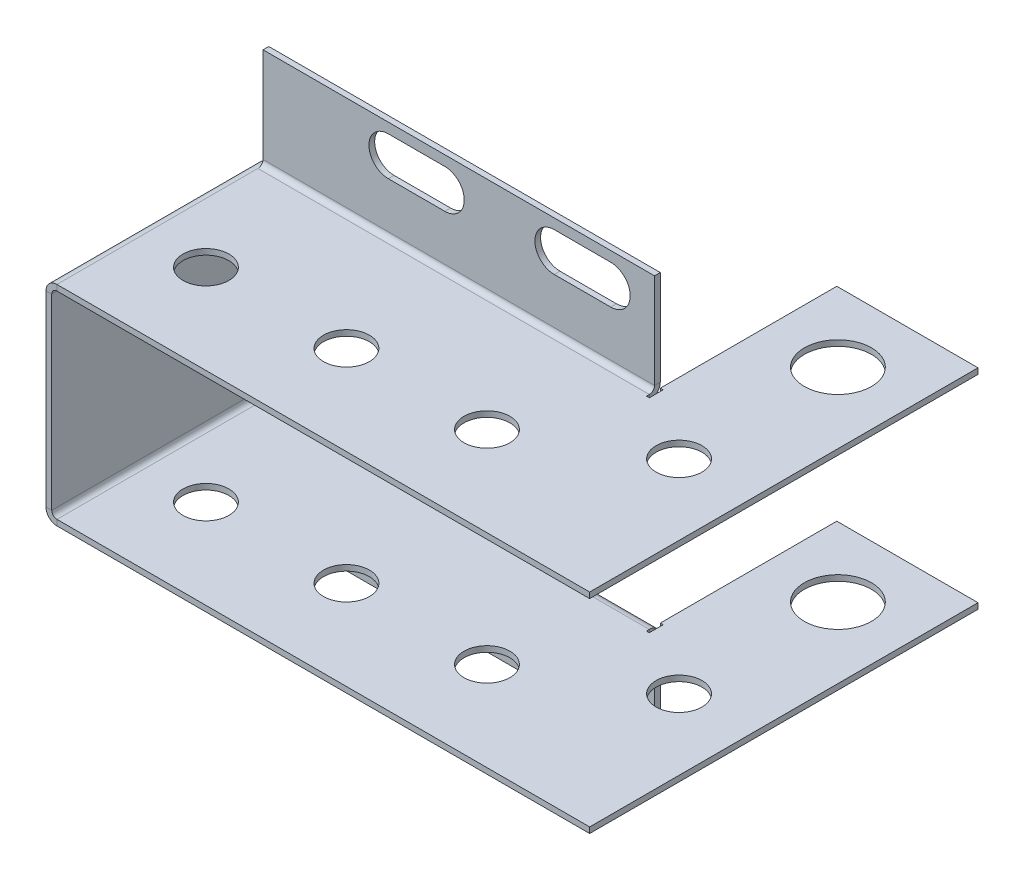
from build123d import *

# Parameters (mm, degrees)
SKETCH7_W                    = 29.6256
SKETCH7_H                    = 30
BASE_FLANGE2_DEPTH           = 0.8128
EDGE_FLANGE1_STRIP_W         = 4.7244
EDGE_FLANGE1_STRIP_H         = 0.8128
EDGE_FLANGE1_STRIP_CUT_DEPTH = 30
EDGE_FLANGE1_DEPTH           = 30
EDGE_FLANGE1_FLAT_DEPTH      = 0.8128
EDGE_FLANGE3_START           = 0.7366
EDGE_FLANGE3_DEPTH           = 55.857
EDGE_FLANGE3_START_2         = 56.1872
EDGE_FLANGE3_2_DEPTH         = 0.4064
EDGE_FLANGE3_3_DEPTH         = 55.4506
CUT_EXTRUDE1_REACH           = 93.006
SKETCH21_R                   = 4.75
SKETCH21_R_2                 = 3.25
CUT_EXTRUDE2_REACH           = 88.587


# Read off the part's stored shape, not the designer's step: Edge-Flange3
# Sheet-metal steps are written as plain solids
with BuildPart() as part:
    # Sketch7 → Base-Flange2 (new body)
    with BuildSketch(Plane.YZ):
        Rectangle(SKETCH7_W, SKETCH7_H)
    extrude(amount=-BASE_FLANGE2_DEPTH)

    # Edge-Flange1 strip (across the edge) → Edge-Flange1 strip cut (cut)
    with BuildSketch(Plane(origin=(0, 14.8128, -15), x_dir=(0, -1, 0), z_dir=(0, 0, 1))):
        with Locations((-0.8128, -0.4064)):
            Rectangle(EDGE_FLANGE1_STRIP_W, EDGE_FLANGE1_STRIP_H)
    edge_flange1_strip_cut = extrude(amount=EDGE_FLANGE1_STRIP_CUT_DEPTH, mode=Mode.SUBTRACT)

    # Edge-Flange1 bend section (across the edge) → Edge-Flange1 (add)
    with BuildSketch(Plane(origin=(0, 14.8128, -15), x_dir=(0, -1, 0), z_dir=(0, 0, 1))):
        with BuildLine():
            Line((0, 0.7366), (0.8128, 0.7366))
            ThreePointArc((0.8128, 0.7366), (1.028545145, 0.215745145), (1.5494, 0))
            Line((1.5494, 0), (1.5494, -0.8128))
            ThreePointArc((1.5494, -0.8128), (0.453808753, -0.358991247), (0, 0.7366))
        make_face()
    edge_flange1 = extrude(amount=EDGE_FLANGE1_DEPTH)

    # Edge-Flange1 profile (on flange) → Edge-Flange1 flat (add)
    with BuildSketch(Plane.ZX.offset(14.8128)):
        Polygon((-40, 56.1872), (-15, 56.1872), (-15, 0.7366), (15, 0.7366), (15, 76.1872), (-40, 76.1872), align=None)
    edge_flange1_flat = extrude(amount=-EDGE_FLANGE1_FLAT_DEPTH)

    # Edge-Flange3 outline → Edge-Flange3 (cut)
    with BuildSketch(Plane.YZ.offset(EDGE_FLANGE3_START)):
        with BuildLine():
            Line((14.8128, -15), (14.8128, -14.813707039))
            ThreePointArc((14.8128, -14.813707039), (14.218624211, -14.244121367), (14, -13.4506))
            Line((14, -13.4506), (14, -15))
            Line((14, -15), (14.8128, -15))
        make_face()
    edge_flange3 = extrude(amount=EDGE_FLANGE3_DEPTH, mode=Mode.SUBTRACT)

    # Edge-Flange3 2 outline → Edge-Flange3 2 (cut)
    with BuildSketch(Plane.YZ.offset(EDGE_FLANGE3_START_2)):
        with BuildLine():
            ThreePointArc((14, -13.4506), (14.218624211, -14.244121367), (14.8128, -14.813707039))
            Line((14.8128, -14.813707039), (14.8128, -13.0442))
            Line((14.8128, -13.0442), (14, -13.0442))
            Line((14, -13.0442), (14, -13.4506))
        make_face()
    edge_flange3_2 = extrude(amount=EDGE_FLANGE3_2_DEPTH, mode=Mode.SUBTRACT)

    # Edge-Flange3 3 outline → Edge-Flange3 3 (add)
    with BuildSketch(Plane.YZ.offset(EDGE_FLANGE3_START)):
        with BuildLine():
            Line((15.5494, -15), (29, -15))
            Line((29, -15), (29, -14.1872))
            Line((29, -14.1872), (15.5494, -14.1872))
            ThreePointArc((15.5494, -14.1872), (15.028545145, -13.971454855), (14.8128, -13.4506))
            Line((14.8128, -13.4506), (14.8128, -14.813707039))
            ThreePointArc((14.8128, -14.813707039), (15.169503755, -14.952704924), (15.5494, -15))
        make_face()
    edge_flange3_3 = extrude(amount=EDGE_FLANGE3_3_DEPTH)

    # Sketch21 → Cut-Extrude1 (cut, up to next)
    with BuildSketch(Plane(origin=(0, 14.8128, 0), x_dir=(-1, 0, 0), z_dir=(0, 1, 0)), mode=Mode.PRIVATE) as cut_extrude1_sk1:
        with Locations((-66.1872, -30.16)):
            Circle(SKETCH21_R)
    cut_extrude1_tool1 = extrude(cut_extrude1_sk1.sketch, amount=-CUT_EXTRUDE1_REACH, mode=Mode.PRIVATE) & part.part
    # Sketch21 → Cut-Extrude1 (cut, up to next)
    with BuildSketch(Plane(origin=(0, 14.8128, 0), x_dir=(-1, 0, 0), z_dir=(0, 1, 0)), mode=Mode.PRIVATE) as cut_extrude1_sk2:
        with Locations((-66.1872, -7.66)):
            Circle(SKETCH21_R_2)
    cut_extrude1_tool2 = extrude(cut_extrude1_sk2.sketch, amount=-CUT_EXTRUDE1_REACH, mode=Mode.PRIVATE) & part.part
    # Sketch21 → Cut-Extrude1 (cut, up to next)
    with BuildSketch(Plane(origin=(0, 14.8128, 0), x_dir=(-1, 0, 0), z_dir=(0, 1, 0)), mode=Mode.PRIVATE) as cut_extrude1_sk3:
        with Locations((-48.982258849, 2.34)):
            Circle(SKETCH21_R_2)
    cut_extrude1_tool3 = extrude(cut_extrude1_sk3.sketch, amount=-CUT_EXTRUDE1_REACH, mode=Mode.PRIVATE) & part.part
    # Sketch21 → Cut-Extrude1 (cut, up to next)
    with BuildSketch(Plane(origin=(0, 14.8128, 0), x_dir=(-1, 0, 0), z_dir=(0, 1, 0)), mode=Mode.PRIVATE) as cut_extrude1_sk4:
        with Locations((-29.082258849, 2.34)):
            Circle(SKETCH21_R_2)
    cut_extrude1_tool4 = extrude(cut_extrude1_sk4.sketch, amount=-CUT_EXTRUDE1_REACH, mode=Mode.PRIVATE) & part.part
    # Sketch21 → Cut-Extrude1 (cut, up to next)
    with BuildSketch(Plane(origin=(0, 14.8128, 0), x_dir=(-1, 0, 0), z_dir=(0, 1, 0)), mode=Mode.PRIVATE) as cut_extrude1_sk5:
        with Locations((-9.182258849, 2.34)):
            Circle(SKETCH21_R_2)
    cut_extrude1_tool5 = extrude(cut_extrude1_sk5.sketch, amount=-CUT_EXTRUDE1_REACH, mode=Mode.PRIVATE) & part.part
    cut_extrude1_1 = cut_extrude1_tool1.solids().sort_by_distance((66.1872, 14.8128, -30.16))[0]
    add(cut_extrude1_1, mode=Mode.SUBTRACT)
    cut_extrude1_2 = cut_extrude1_tool2.solids().sort_by_distance((66.1872, 14.8128, -7.66))[0]
    add(cut_extrude1_2, mode=Mode.SUBTRACT)
    cut_extrude1_3 = cut_extrude1_tool3.solids().sort_by_distance((48.982259, 14.8128, 2.34))[0]
    add(cut_extrude1_3, mode=Mode.SUBTRACT)
    cut_extrude1_4 = cut_extrude1_tool4.solids().sort_by_distance((29.082259, 14.8128, 2.34))[0]
    add(cut_extrude1_4, mode=Mode.SUBTRACT)
    cut_extrude1_5 = cut_extrude1_tool5.solids().sort_by_distance((9.182259, 14.8128, 2.34))[0]
    add(cut_extrude1_5, mode=Mode.SUBTRACT)
    cut_extrude1 = cut_extrude1_1 + cut_extrude1_2 + cut_extrude1_3 + cut_extrude1_4 + cut_extrude1_5  # Cut-Extrude1 as one shape, for the pattern or mirror that repeats it

    # Sketch22 → Cut-Extrude2 (cut, up to next)
    with BuildSketch(Plane.XY.offset(-14.1872), mode=Mode.PRIVATE) as cut_extrude2_sk1:
        with BuildLine():
            Line((18.4866, 27.5628), (26.4866, 27.5628))
            ThreePointArc((26.4866, 27.5628), (29.2366, 24.8128), (26.4866, 22.0628))
            Line((26.4866, 22.0628), (18.4866, 22.0628))
            ThreePointArc((18.4866, 22.0628), (15.7366, 24.8128), (18.4866, 27.5628))
        make_face()
    cut_extrude2_tool1 = extrude(cut_extrude2_sk1.sketch, amount=-CUT_EXTRUDE2_REACH, mode=Mode.PRIVATE) & part.part
    # Sketch22 → Cut-Extrude2 (cut, up to next)
    with BuildSketch(Plane.XY.offset(-14.1872), mode=Mode.PRIVATE) as cut_extrude2_sk2:
        with BuildLine():
            Line((49.9866, 27.5628), (41.9866, 27.5628))
            ThreePointArc((41.9866, 27.5628), (39.2366, 24.8128), (41.9866, 22.0628))
            Line((41.9866, 22.0628), (49.9866, 22.0628))
            ThreePointArc((49.9866, 22.0628), (52.7366, 24.8128), (49.9866, 27.5628))
        make_face()
    cut_extrude2_tool2 = extrude(cut_extrude2_sk2.sketch, amount=-CUT_EXTRUDE2_REACH, mode=Mode.PRIVATE) & part.part
    cut_extrude2_1 = cut_extrude2_tool1.solids().sort_by_distance((22.4866, 24.8128, -14.1872))[0]
    add(cut_extrude2_1, mode=Mode.SUBTRACT)
    cut_extrude2_2 = cut_extrude2_tool2.solids().sort_by_distance((45.9866, 24.8128, -14.1872))[0]
    add(cut_extrude2_2, mode=Mode.SUBTRACT)
    cut_extrude2 = cut_extrude2_1 + cut_extrude2_2  # Cut-Extrude2 as one shape, for the pattern or mirror that repeats it

    # Mirror1: Edge-Flange1 strip cut, Edge-Flange1, Edge-Flange1 flat, Edge-Flange3, Edge-Flange3 2, Edge-Flange3 3, Cut-Extrude1, Cut-Extrude2 across plane
    add(edge_flange1_strip_cut.mirror(Plane.ZX), mode=Mode.SUBTRACT)
    add(edge_flange1.mirror(Plane.ZX))
    add(edge_flange1_flat.mirror(Plane.ZX))
    add(edge_flange3.mirror(Plane.ZX), mode=Mode.SUBTRACT)
    add(edge_flange3_2.mirror(Plane.ZX), mode=Mode.SUBTRACT)
    add(edge_flange3_3.mirror(Plane.ZX))
    add(cut_extrude1.mirror(Plane.ZX), mode=Mode.SUBTRACT)
    add(cut_extrude2.mirror(Plane.ZX), mode=Mode.SUBTRACT)


solid = part.part
